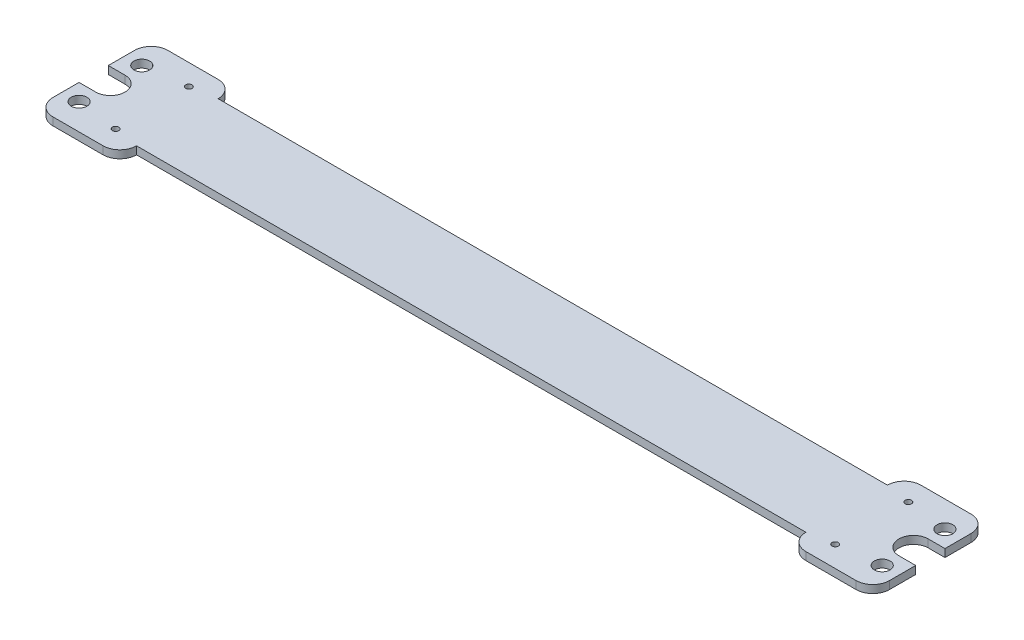
from build123d import *

# Parameters (mm, degrees)
SKETCH1_R           = 4.7625
SKETCH1_R_2         = 1.905
BOSS_EXTRUDE1_DEPTH = 4.7625


with BuildPart() as part:
    # Sketch1 → Boss-Extrude1 (new body)
    with BuildSketch(Plane(origin=(0, 0, 0), x_dir=(1, 0, 0), z_dir=(0, 1, 0))):
        with BuildLine():
            Line((10.16, 0), (40.64, 0))
            ThreePointArc((40.64, 0), (47.824204897, -2.975795103), (50.8, -10.16))
            Line((50.8, -10.16), (254, -10.16))
            Line((254, -10.16), (254, -59.69))
            Line((254, -59.69), (50.8, -59.69))
            ThreePointArc((50.8, -59.69), (47.824204897, -66.874204897), (40.64, -69.85))
            Line((40.64, -69.85), (10.16, -69.85))
            ThreePointArc((10.16, -69.85), (2.975795103, -66.874204897), (0, -59.69))
            Line((0, -59.69), (0, -43.815))
            Line((0, -43.815), (10.16, -43.815))
            ThreePointArc((10.16, -43.815), (19.05, -34.925), (10.16, -26.035))
            Line((10.16, -26.035), (0, -26.035))
            Line((0, -26.035), (0, -10.16))
            ThreePointArc((0, -10.16), (2.975795103, -2.975795103), (10.16, 0))
        make_face()
        with Locations((10.16, -53.975)):
            Circle(SKETCH1_R, mode=Mode.SUBTRACT)
        with Locations((10.16, -15.875)):
            Circle(SKETCH1_R, mode=Mode.SUBTRACT)
        with Locations((35.56, -57.15)):
            Circle(SKETCH1_R_2, mode=Mode.SUBTRACT)
        with Locations((35.56, -12.7)):
            Circle(SKETCH1_R_2, mode=Mode.SUBTRACT)
    boss_extrude1 = extrude(amount=BOSS_EXTRUDE1_DEPTH)

    # Mirror1: Boss-Extrude1 across plane
    add(boss_extrude1.mirror(Plane(origin=(254, 4.7625, 59.69), x_dir=(0, 0, 1), z_dir=(-1, 0, 0))))


solid = part.part
